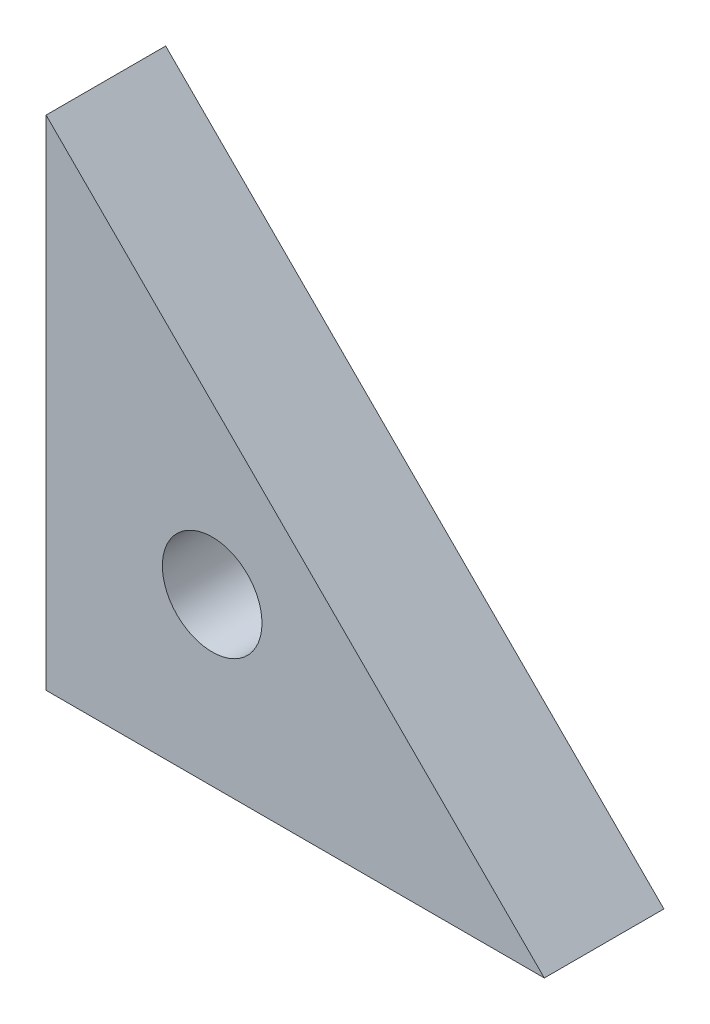
from build123d import *

# Parameters (mm, degrees)
T_LE_DE_BASE_PLI_E1_DEPTH = 6
TROU_TARAUD_M61_D         = 5


# Sheet-metal steps are written as plain solids
with BuildPart() as part:
    # Esquisse2 → Tôle de base pliée1 (new body)
    with BuildSketch(Plane.XY):
        Polygon((0, 0), (0, 25), (25, 0), align=None)
    extrude(amount=-T_LE_DE_BASE_PLI_E1_DEPTH)

    # Trou taraudé M61 (through all)
    with Locations(Plane.XY):
        with Locations((8.333333333, 8.333333333)):
            Hole(TROU_TARAUD_M61_D / 2)


solid = part.part
